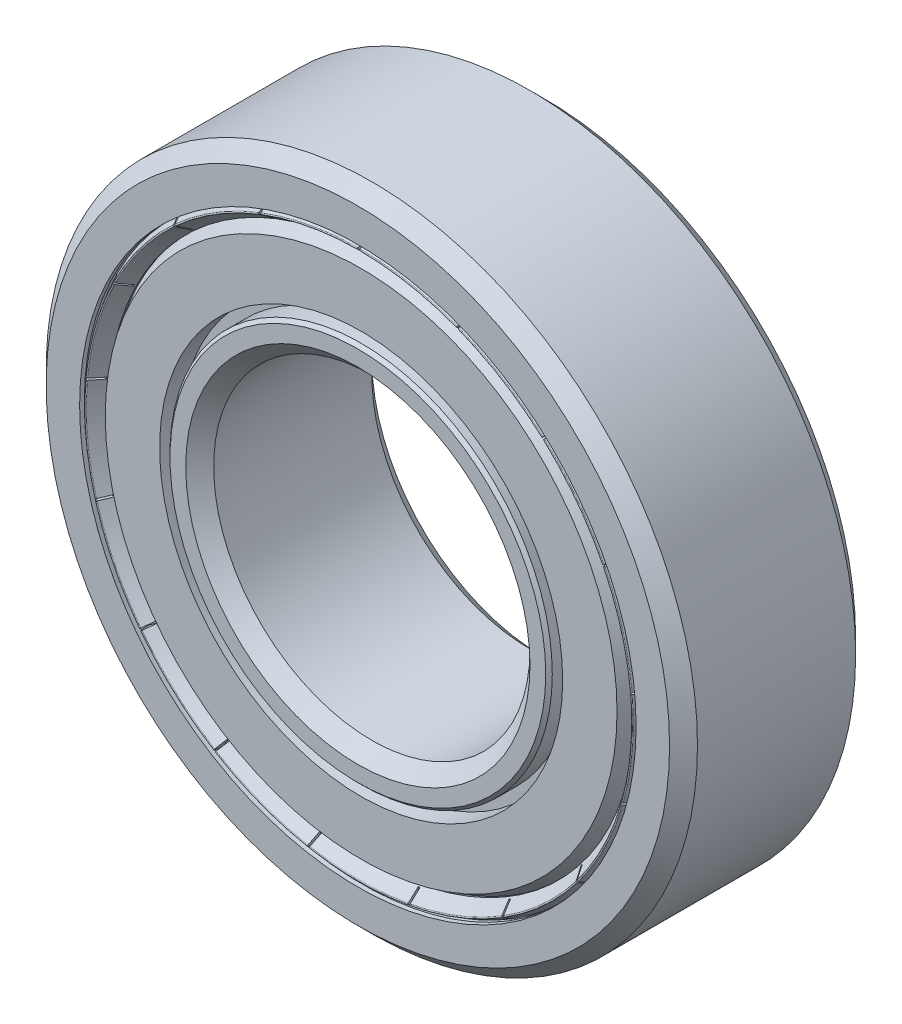
from build123d import *

# Parameters (mm, degrees)
CIRPATTERN1_COUNT  = 9
FILLET1_R          = 0.05
CUT_EXTRUDE1_START = 4.321819
CUT_EXTRUDE1_DEPTH = 21.926943346
CIRPATTERN2_COUNT  = 17


with BuildPart() as part:
    # Sketch3 → Revolve1 (revolve)
    with BuildSketch(Plane(origin=(0, 0, 0), x_dir=(0, 0, -1), z_dir=(1, 0, 0)), mode=Mode.PRIVATE) as revolve1_sk:
        with BuildLine():
            Line((4.25, 17.5), (-4.25, 17.5))
            Line((-4.25, 17.5), (-5, 16.75))
            Line((-5, 16.75), (-5, 14.952406653))
            Line((-5, 14.952406653), (-4.75, 14.952406653))
            Line((-4.75, 14.952406653), (-4.75, 15.551203327))
            Line((-4.75, 15.551203327), (-4.573223305, 15.727980022))
            Line((-4.573223305, 15.727980022), (-1.575, 15.727980022))
            ThreePointArc((-1.575, 15.727980022), (0, 16.15), (1.575, 15.727980022))
            Line((1.575, 15.727980022), (4.573223305, 15.727980022))
            Line((4.573223305, 15.727980022), (4.75, 15.551203327))
            Line((4.75, 15.551203327), (4.75, 14.952406653))
            Line((4.75, 14.952406653), (5, 14.952406653))
            Line((5, 14.952406653), (5, 16.75))
            Line((5, 16.75), (4.25, 17.5))
        make_face()
        with BuildLine():
            Line((4.25, 8.5), (-4.25, 8.5))
            Line((-4.25, 8.5), (-5, 9.25))
            Line((-5, 9.25), (-5, 10.095243283))
            Line((-5, 10.095243283), (-4.823223305, 10.272019978))
            Line((-4.823223305, 10.272019978), (-1.575, 10.272019978))
            ThreePointArc((-1.575, 10.272019978), (0, 9.85), (1.575, 10.272019978))
            Line((1.575, 10.272019978), (4.823223305, 10.272019978))
            Line((4.823223305, 10.272019978), (5, 10.095243283))
            Line((5, 10.095243283), (5, 9.25))
            Line((5, 9.25), (4.25, 8.5))
        make_face()
    revolve(revolve1_sk.sketch.rotate(Axis((0, 0, 5), (0, 0, -1)), 90), axis=Axis((0, 0, 5), (0, 0, -1)))


with BuildPart() as body_2:
    # Sketch4 → Revolve2 (revolve)
    with BuildSketch(Plane(origin=(0, 0, 0), x_dir=(0, 0, -1), z_dir=(1, 0, 0))):
        with BuildLine():
            Line((0, 16.15), (0, 9.85))
            ThreePointArc((0, 9.85), (-3.15, 13), (0, 16.15))
        make_face()
    revolve(axis=Axis((0, 17.5, 0), (0, -1, 0)))


with BuildPart() as cirpattern1_1:
    # CirPattern1: pattern copy
    add(body_2.part.rotate(Axis((0, 0, 0), (0, 0, 1)), 1 * 360 / CIRPATTERN1_COUNT))


with BuildPart() as cirpattern1_2:
    # CirPattern1: pattern copy
    add(body_2.part.rotate(Axis((0, 0, 0), (0, 0, 1)), 2 * 360 / CIRPATTERN1_COUNT))


with BuildPart() as cirpattern1_3:
    # CirPattern1: pattern copy
    add(body_2.part.rotate(Axis((0, 0, 0), (0, 0, 1)), 3 * 360 / CIRPATTERN1_COUNT))


with BuildPart() as cirpattern1_4:
    # CirPattern1: pattern copy
    add(body_2.part.rotate(Axis((0, 0, 0), (0, 0, 1)), 4 * 360 / CIRPATTERN1_COUNT))


with BuildPart() as cirpattern1_5:
    # CirPattern1: pattern copy
    add(body_2.part.rotate(Axis((0, 0, 0), (0, 0, 1)), 5 * 360 / CIRPATTERN1_COUNT))


with BuildPart() as cirpattern1_6:
    # CirPattern1: pattern copy
    add(body_2.part.rotate(Axis((0, 0, 0), (0, 0, 1)), 6 * 360 / CIRPATTERN1_COUNT))


with BuildPart() as cirpattern1_7:
    # CirPattern1: pattern copy
    add(body_2.part.rotate(Axis((0, 0, 0), (0, 0, 1)), 7 * 360 / CIRPATTERN1_COUNT))


with BuildPart() as cirpattern1_8:
    # CirPattern1: pattern copy
    add(body_2.part.rotate(Axis((0, 0, 0), (0, 0, 1)), 8 * 360 / CIRPATTERN1_COUNT))


with BuildPart() as body_11:
    # Sketch5 → Revolve3 (revolve)
    with BuildSketch(Plane(origin=(0, 0, 0), x_dir=(0, 0, -1), z_dir=(1, 0, 0)), mode=Mode.PRIVATE) as revolve3_sk:
        Polygon((-3.15, 10.272019978), (-3.707741102, 10.272019978), (-3.707741102, 10.82976108), (-4.823223305, 10.82976108), (-4.823223305, 13.750641601), (-3.707741102, 14.394665552), (-3.15, 14.394665552), align=None)
        Polygon((3.707741102, 14.394665552), (3.15, 14.394665552), (3.15, 10.272019978), (3.707741102, 10.272019978), (3.707741102, 10.82976108), (4.823223305, 10.82976108), (4.823223305, 13.750641601), align=None)
    revolve(revolve3_sk.sketch.rotate(Axis((0, 0, 5), (0, 0, -1)), 90), axis=Axis((0, 0, 5), (0, 0, -1)))


with BuildPart() as body_12:
    # Sketch6 → Revolve4 (revolve)
    with BuildSketch(Plane(origin=(0, 0, 0), x_dir=(0, 0, -1), z_dir=(1, 0, 0)), mode=Mode.PRIVATE) as revolve4_sk:
        Polygon((-4.081137305, 14.952406653), (-4.5625, 14.952406653), (-5, 14.69981591), (-4.231137305, 14.161452455), (-4.181137305, 14.161452455), (-4.081137305, 14.179085153), align=None)
    revolve(revolve4_sk.sketch.rotate(Axis((0, 0, 5), (0, 0, -1)), 90), axis=Axis((0, 0, 5), (0, 0, -1)))

    # Fillet1
    fillet1_edges = [body_12.edges().sort_by_distance(p)[0] for p in [
        (-14.69981591, 0, 5),
    ]]
    fillet(fillet1_edges, radius=FILLET1_R)

    # Sketch7 → Cut-Extrude1 (cut, through all)
    with BuildSketch(Plane.XY.offset(CUT_EXTRUDE1_START)):
        Polygon((-0.05, 14.952406653), (-0.05, 15.052406653), (0.05, 15.052406653), (0.05, 14.952406653), (0.05, 14.161452455), (0.05, 14.061452455), (-0.05, 14.061452455), (-0.05, 14.161452455), align=None)
    cut_extrude1 = extrude(amount=CUT_EXTRUDE1_DEPTH, mode=Mode.SUBTRACT)

    # CirPattern2: Cut-Extrude1 ×17 about axis
    cirpattern2_axis = Axis((0, 0, 0), (0, 0, 1))
    for i in range(1, CIRPATTERN2_COUNT):
        add(cut_extrude1.rotate(cirpattern2_axis, i * 360 / CIRPATTERN2_COUNT), mode=Mode.SUBTRACT)


with BuildPart() as body_13:
    # Mirror1: mirrored copy
    add(body_12.part.mirror(Plane.XY))


solid = Compound([part.part, body_2.part, cirpattern1_1.part, cirpattern1_2.part, cirpattern1_3.part, cirpattern1_4.part, cirpattern1_5.part, cirpattern1_6.part, cirpattern1_7.part, cirpattern1_8.part, body_11.part, body_12.part, body_13.part])
